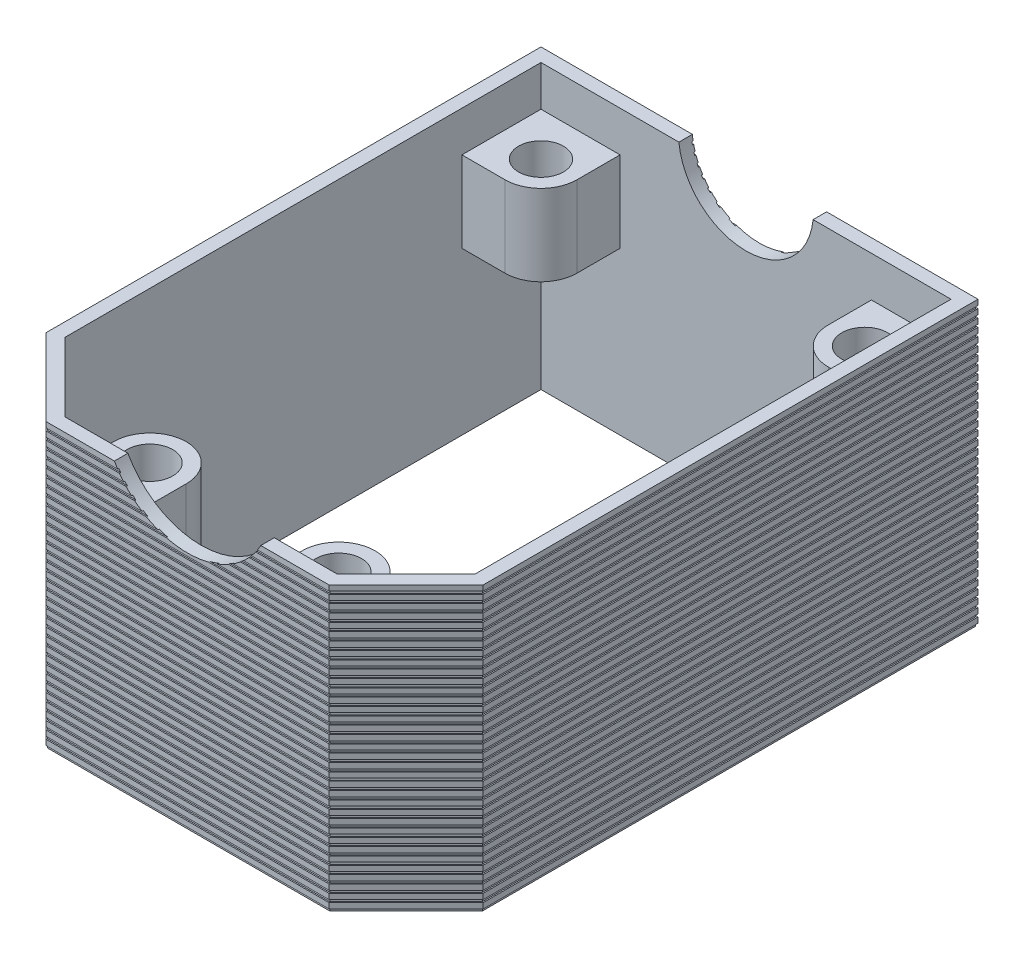
from build123d import *

# Parameters (mm, degrees)
BOSS_EXTRUDE1_DEPTH      = 9
BOSS_EXTRUDE1_DEPTH_BACK = 12
SKETCH4_R                = 1.7
SKETCH4_R_2              = 1.661505774
BOSS_EXTRUDE2_DEPTH      = 6
SKETCH6_R                = 6.2
CUT_EXTRUDE4_DEPTH       = 1
SKETCH5_R                = 5
CUT_EXTRUDE5_DEPTH       = 1
SKETCH7_W                = 32.4
SKETCH7_H                = 0.2
CUT_EXTRUDE6_DEPTH       = 0.09
SKETCH8_W                = 36.607056275
SKETCH8_H                = 0.2
CUT_EXTRUDE7_DEPTH       = 0.09
SKETCH9_W                = 8.065180362
SKETCH9_H                = 0.2
CUT_EXTRUDE8_DEPTH       = 0.09
SKETCH10_W               = 20.99411255
SKETCH10_H               = 0.2
CUT_EXTRUDE9_DEPTH       = 0.09
SKETCH11_W               = 8.065180362
SKETCH11_H               = 0.2
CUT_EXTRUDE10_DEPTH      = 0.09
SKETCH12_W               = 36.607056275
SKETCH12_H               = 0.2
CUT_EXTRUDE11_DEPTH      = 0.09


with BuildPart() as part:
    # Sketch2 → Boss-Extrude1 (new, two sides: drawn at the far end of the back side and taken through both)
    with BuildSketch(Plane(origin=(0, 0, 0), x_dir=(1, 0, 0), z_dir=(0, 1, 0)).offset(-BOSS_EXTRUDE1_DEPTH_BACK)):
        Polygon((-16.2, 21.2), (16.2, 21.2), (16.2, -15.497056275), (10.497056275, -21.2), (-10.497056275, -21.2), (-16.2, -15.497056275), align=None)
        Polygon((-15.2, 20.2), (15.2, 20.2), (15.2, -15.082842712), (10.082842712, -20.2), (-10.082842712, -20.2), (-15.2, -15.082842712), align=None, mode=Mode.SUBTRACT)
    extrude(amount=BOSS_EXTRUDE1_DEPTH + BOSS_EXTRUDE1_DEPTH_BACK)

    # Sketch4 → Boss-Extrude2 (add)
    # profile 1 of 4: a face of its own
    with BuildSketch(Plane(origin=(0, 0, 0), x_dir=(1, 0, 0), z_dir=(0, 1, 0))):
        with BuildLine():
            Line((9.3, 17), (9.3, 20.2))
            Line((9.3, 20.2), (15.2, 20.2))
            Line((15.2, 20.2), (15.2, 14.3))
            Line((15.2, 14.3), (12, 14.3))
            ThreePointArc((12, 14.3), (10.090811691, 15.090811691), (9.3, 17))
        make_face()
        with Locations(Location((12, 17, 0), (0, 0, 270))):
            Circle(SKETCH4_R, mode=Mode.SUBTRACT)
    # profile 2 of 4: a face of its own
    with BuildSketch(Plane(origin=(0, 0, 0), x_dir=(1, 0, 0), z_dir=(0, 1, 0))):
        with BuildLine():
            Line((-9.7, -17), (-9.7, -20.2))
            Line((-9.7, -20.2), (-4.3, -20.2))
            Line((-4.3, -20.2), (-4.3, -17))
            ThreePointArc((-4.3, -17), (-7, -14.3), (-9.7, -17))
        make_face()
        with Locations(Location((-7, -17, 0), (0, 0, 270))):
            Circle(SKETCH4_R, mode=Mode.SUBTRACT)
    # profile 3 of 4: a face of its own
    with BuildSketch(Plane(origin=(0, 0, 0), x_dir=(1, 0, 0), z_dir=(0, 1, 0))):
        with BuildLine():
            Line((4.3, -17), (4.3, -20.2))
            Line((4.3, -20.2), (9.7, -20.2))
            Line((9.7, -20.2), (9.7, -17))
            ThreePointArc((9.7, -17), (7, -14.3), (4.3, -17))
        make_face()
        with Locations(Location((7, -17, 0), (0, 0, 270))):
            Circle(SKETCH4_R, mode=Mode.SUBTRACT)
    # profile 4 of 4: a face of its own
    with BuildSketch(Plane(origin=(0, 0, 0), x_dir=(1, 0, 0), z_dir=(0, 1, 0))):
        with BuildLine():
            Line((-9.338494226, 17), (-9.338494226, 20.2))
            Line((-9.338494226, 20.2), (-15.2, 20.2))
            Line((-15.2, 20.2), (-15.2, 14.338494226))
            Line((-15.2, 14.338494226), (-12, 14.338494226))
            ThreePointArc((-12, 14.338494226), (-10.118031219, 15.118031219), (-9.338494226, 17))
        make_face()
        with Locations(Location((-12, 17, 0), (0, 0, 270))):
            Circle(SKETCH4_R_2, mode=Mode.SUBTRACT)
    extrude(amount=BOSS_EXTRUDE2_DEPTH)

    # Sketch6 → Cut-Extrude4 (cut)
    with BuildSketch(Plane.XY.offset(21.2)):
        with Locations((0, 12)):
            Circle(SKETCH6_R)
    extrude(amount=-CUT_EXTRUDE4_DEPTH, mode=Mode.SUBTRACT)

    # Sketch5 → Cut-Extrude5 (cut)
    with BuildSketch(Plane(origin=(0, 0, -21.2), x_dir=(-1, 0, 0), z_dir=(0, 0, -1))):
        with Locations((0, 9.5)):
            Circle(SKETCH5_R)
    extrude(amount=-CUT_EXTRUDE5_DEPTH, mode=Mode.SUBTRACT)

    # Sketch7 → Cut-Extrude6 (cut)
    with BuildSketch(Plane(origin=(0, 0, -21.2), x_dir=(-1, 0, 0), z_dir=(0, 0, -1))):
        with Locations((0, -11.9)):
            Rectangle(SKETCH7_W, SKETCH7_H)
        with Locations((0, -11.3)):
            Rectangle(SKETCH7_W, SKETCH7_H)
        with Locations((0, -10.7)):
            Rectangle(SKETCH7_W, SKETCH7_H)
        with Locations((0, -10.1)):
            Rectangle(SKETCH7_W, SKETCH7_H)
        with Locations((0, -9.5)):
            Rectangle(SKETCH7_W, SKETCH7_H)
        with Locations((0, -8.9)):
            Rectangle(SKETCH7_W, SKETCH7_H)
        with Locations((0, -8.3)):
            Rectangle(SKETCH7_W, SKETCH7_H)
        with Locations((0, -7.7)):
            Rectangle(SKETCH7_W, SKETCH7_H)
        with Locations((0, -7.1)):
            Rectangle(SKETCH7_W, SKETCH7_H)
        with Locations((0, -6.5)):
            Rectangle(SKETCH7_W, SKETCH7_H)
        with Locations((0, -5.9)):
            Rectangle(SKETCH7_W, SKETCH7_H)
        with Locations((0, -5.3)):
            Rectangle(SKETCH7_W, SKETCH7_H)
        with Locations((0, -4.7)):
            Rectangle(SKETCH7_W, SKETCH7_H)
        with Locations((0, -4.1)):
            Rectangle(SKETCH7_W, SKETCH7_H)
        with Locations((0, -3.5)):
            Rectangle(SKETCH7_W, SKETCH7_H)
        with Locations((0, -2.9)):
            Rectangle(SKETCH7_W, SKETCH7_H)
        with Locations((0, -2.3)):
            Rectangle(SKETCH7_W, SKETCH7_H)
        with Locations((0, -1.7)):
            Rectangle(SKETCH7_W, SKETCH7_H)
        with Locations((0, -1.1)):
            Rectangle(SKETCH7_W, SKETCH7_H)
        with Locations((0, -0.5)):
            Rectangle(SKETCH7_W, SKETCH7_H)
        with Locations((0, 0.1)):
            Rectangle(SKETCH7_W, SKETCH7_H)
        with Locations((0, 0.7)):
            Rectangle(SKETCH7_W, SKETCH7_H)
        with Locations((0, 1.3)):
            Rectangle(SKETCH7_W, SKETCH7_H)
        with Locations((0, 1.9)):
            Rectangle(SKETCH7_W, SKETCH7_H)
        with Locations((0, 2.5)):
            Rectangle(SKETCH7_W, SKETCH7_H)
        with Locations((0, 3.1)):
            Rectangle(SKETCH7_W, SKETCH7_H)
        with Locations((0, 3.7)):
            Rectangle(SKETCH7_W, SKETCH7_H)
        with Locations((0, 4.3)):
            Rectangle(SKETCH7_W, SKETCH7_H)
        with Locations((0, 4.9)):
            Rectangle(SKETCH7_W, SKETCH7_H)
        with Locations((0, 5.5)):
            Rectangle(SKETCH7_W, SKETCH7_H)
        with Locations((0, 6.1)):
            Rectangle(SKETCH7_W, SKETCH7_H)
        with Locations((0, 6.7)):
            Rectangle(SKETCH7_W, SKETCH7_H)
        with Locations((0, 7.3)):
            Rectangle(SKETCH7_W, SKETCH7_H)
        with Locations((0, 7.9)):
            Rectangle(SKETCH7_W, SKETCH7_H)
        with Locations((0, 8.5)):
            Rectangle(SKETCH7_W, SKETCH7_H)
        with Locations((0, 9.1)):
            Rectangle(SKETCH7_W, SKETCH7_H)
        with Locations((0, 9.7)):
            Rectangle(SKETCH7_W, SKETCH7_H)
        with Locations((0, 10.3)):
            Rectangle(SKETCH7_W, SKETCH7_H)
        with Locations((0, 10.9)):
            Rectangle(SKETCH7_W, SKETCH7_H)
        with Locations((0, 11.5)):
            Rectangle(SKETCH7_W, SKETCH7_H)
    extrude(amount=-CUT_EXTRUDE6_DEPTH, mode=Mode.SUBTRACT)

    # Sketch8 → Cut-Extrude7 (cut)
    with BuildSketch(Plane(origin=(16.2, 0, 0), x_dir=(0, 0, -1), z_dir=(1, 0, 0))):
        with Locations((2.806471863, -11.3)):
            Rectangle(SKETCH8_W, SKETCH8_H)
        with Locations((2.806471863, -11.9)):
            Rectangle(SKETCH8_W, SKETCH8_H)
        with Locations((2.806471863, -10.7)):
            Rectangle(SKETCH8_W, SKETCH8_H)
        with Locations((2.806471863, -10.1)):
            Rectangle(SKETCH8_W, SKETCH8_H)
        with Locations((2.806471863, -9.5)):
            Rectangle(SKETCH8_W, SKETCH8_H)
        with Locations((2.806471863, -8.9)):
            Rectangle(SKETCH8_W, SKETCH8_H)
        with Locations((2.806471863, -8.3)):
            Rectangle(SKETCH8_W, SKETCH8_H)
        with Locations((2.806471863, -7.7)):
            Rectangle(SKETCH8_W, SKETCH8_H)
        with Locations((2.806471863, -7.1)):
            Rectangle(SKETCH8_W, SKETCH8_H)
        with Locations((2.806471863, -6.5)):
            Rectangle(SKETCH8_W, SKETCH8_H)
        with Locations((2.806471863, -5.9)):
            Rectangle(SKETCH8_W, SKETCH8_H)
        with Locations((2.806471863, -5.3)):
            Rectangle(SKETCH8_W, SKETCH8_H)
        with Locations((2.806471863, -4.7)):
            Rectangle(SKETCH8_W, SKETCH8_H)
        with Locations((2.806471863, -4.1)):
            Rectangle(SKETCH8_W, SKETCH8_H)
        with Locations((2.806471863, -3.5)):
            Rectangle(SKETCH8_W, SKETCH8_H)
        with Locations((2.806471863, -2.9)):
            Rectangle(SKETCH8_W, SKETCH8_H)
        with Locations((2.806471863, -2.3)):
            Rectangle(SKETCH8_W, SKETCH8_H)
        with Locations((2.806471863, -1.7)):
            Rectangle(SKETCH8_W, SKETCH8_H)
        with Locations((2.806471863, -1.1)):
            Rectangle(SKETCH8_W, SKETCH8_H)
        with Locations((2.806471863, -0.5)):
            Rectangle(SKETCH8_W, SKETCH8_H)
        with Locations((2.806471863, 0.1)):
            Rectangle(SKETCH8_W, SKETCH8_H)
        with Locations((2.806471863, 0.7)):
            Rectangle(SKETCH8_W, SKETCH8_H)
        with Locations((2.806471863, 1.3)):
            Rectangle(SKETCH8_W, SKETCH8_H)
        with Locations((2.806471863, 1.9)):
            Rectangle(SKETCH8_W, SKETCH8_H)
        with Locations((2.806471863, 2.5)):
            Rectangle(SKETCH8_W, SKETCH8_H)
        with Locations((2.806471863, 3.1)):
            Rectangle(SKETCH8_W, SKETCH8_H)
        with Locations((2.806471863, 3.7)):
            Rectangle(SKETCH8_W, SKETCH8_H)
        with Locations((2.806471863, 4.3)):
            Rectangle(SKETCH8_W, SKETCH8_H)
        with Locations((2.806471863, 4.9)):
            Rectangle(SKETCH8_W, SKETCH8_H)
        with Locations((2.806471863, 5.5)):
            Rectangle(SKETCH8_W, SKETCH8_H)
        with Locations((2.806471863, 6.1)):
            Rectangle(SKETCH8_W, SKETCH8_H)
        with Locations((2.806471863, 6.7)):
            Rectangle(SKETCH8_W, SKETCH8_H)
        with Locations((2.806471863, 7.3)):
            Rectangle(SKETCH8_W, SKETCH8_H)
        with Locations((2.806471863, 7.9)):
            Rectangle(SKETCH8_W, SKETCH8_H)
        with Locations((2.806471863, 8.5)):
            Rectangle(SKETCH8_W, SKETCH8_H)
        with Locations((2.806471863, 9.1)):
            Rectangle(SKETCH8_W, SKETCH8_H)
        with Locations((2.806471863, 9.7)):
            Rectangle(SKETCH8_W, SKETCH8_H)
    extrude(amount=-CUT_EXTRUDE7_DEPTH, mode=Mode.SUBTRACT)

    # Sketch9 → Cut-Extrude8 (cut)
    with BuildSketch(Plane(origin=(15.848528137, 0, 15.848528137), x_dir=(0.7071067811865476, 0, -0.7071067811865476), z_dir=(0.7071067811865476, 0, 0.7071067811865476))):
        with Locations((-3.535533906, -11.3)):
            Rectangle(SKETCH9_W, SKETCH9_H)
        with Locations((-3.535533906, -11.9)):
            Rectangle(SKETCH9_W, SKETCH9_H)
        with Locations((-3.535533906, -10.7)):
            Rectangle(SKETCH9_W, SKETCH9_H)
        with Locations((-3.535533906, -10.1)):
            Rectangle(SKETCH9_W, SKETCH9_H)
        with Locations((-3.535533906, -9.5)):
            Rectangle(SKETCH9_W, SKETCH9_H)
        with Locations((-3.535533906, -8.9)):
            Rectangle(SKETCH9_W, SKETCH9_H)
        with Locations((-3.535533906, -8.3)):
            Rectangle(SKETCH9_W, SKETCH9_H)
        with Locations((-3.535533906, -7.7)):
            Rectangle(SKETCH9_W, SKETCH9_H)
        with Locations((-3.535533906, -7.1)):
            Rectangle(SKETCH9_W, SKETCH9_H)
        with Locations((-3.535533906, -6.5)):
            Rectangle(SKETCH9_W, SKETCH9_H)
        with Locations((-3.535533906, -5.9)):
            Rectangle(SKETCH9_W, SKETCH9_H)
        with Locations((-3.535533906, -5.3)):
            Rectangle(SKETCH9_W, SKETCH9_H)
        with Locations((-3.535533906, -4.7)):
            Rectangle(SKETCH9_W, SKETCH9_H)
        with Locations((-3.535533906, -4.1)):
            Rectangle(SKETCH9_W, SKETCH9_H)
        with Locations((-3.535533906, -3.5)):
            Rectangle(SKETCH9_W, SKETCH9_H)
        with Locations((-3.535533906, -2.9)):
            Rectangle(SKETCH9_W, SKETCH9_H)
        with Locations((-3.535533906, -2.3)):
            Rectangle(SKETCH9_W, SKETCH9_H)
        with Locations((-3.535533906, -1.7)):
            Rectangle(SKETCH9_W, SKETCH9_H)
        with Locations((-3.535533906, -1.1)):
            Rectangle(SKETCH9_W, SKETCH9_H)
        with Locations((-3.535533906, -0.5)):
            Rectangle(SKETCH9_W, SKETCH9_H)
        with Locations((-3.535533906, 0.1)):
            Rectangle(SKETCH9_W, SKETCH9_H)
        with Locations((-3.535533906, 0.7)):
            Rectangle(SKETCH9_W, SKETCH9_H)
        with Locations((-3.535533906, 1.3)):
            Rectangle(SKETCH9_W, SKETCH9_H)
        with Locations((-3.535533906, 1.9)):
            Rectangle(SKETCH9_W, SKETCH9_H)
        with Locations((-3.535533906, 2.5)):
            Rectangle(SKETCH9_W, SKETCH9_H)
        with Locations((-3.535533906, 3.1)):
            Rectangle(SKETCH9_W, SKETCH9_H)
        with Locations((-3.535533906, 3.7)):
            Rectangle(SKETCH9_W, SKETCH9_H)
        with Locations((-3.535533906, 4.3)):
            Rectangle(SKETCH9_W, SKETCH9_H)
        with Locations((-3.535533906, 4.9)):
            Rectangle(SKETCH9_W, SKETCH9_H)
        with Locations((-3.535533906, 5.5)):
            Rectangle(SKETCH9_W, SKETCH9_H)
        with Locations((-3.535533906, 6.1)):
            Rectangle(SKETCH9_W, SKETCH9_H)
        with Locations((-3.535533906, 6.7)):
            Rectangle(SKETCH9_W, SKETCH9_H)
        with Locations((-3.535533906, 7.3)):
            Rectangle(SKETCH9_W, SKETCH9_H)
        with Locations((-3.535533906, 7.9)):
            Rectangle(SKETCH9_W, SKETCH9_H)
        with Locations((-3.535533906, 8.5)):
            Rectangle(SKETCH9_W, SKETCH9_H)
        with Locations((-3.535533906, 9.1)):
            Rectangle(SKETCH9_W, SKETCH9_H)
        with Locations((-3.535533906, 9.7)):
            Rectangle(SKETCH9_W, SKETCH9_H)
    extrude(amount=-CUT_EXTRUDE8_DEPTH, mode=Mode.SUBTRACT)

    # Sketch10 → Cut-Extrude9 (cut)
    with BuildSketch(Plane.XY.offset(21.2)):
        with Locations((0, -11.3)):
            Rectangle(SKETCH10_W, SKETCH10_H)
        with Locations((0, -11.9)):
            Rectangle(SKETCH10_W, SKETCH10_H)
        with Locations((0, -10.7)):
            Rectangle(SKETCH10_W, SKETCH10_H)
        with Locations((0, -10.1)):
            Rectangle(SKETCH10_W, SKETCH10_H)
        with Locations((0, -9.5)):
            Rectangle(SKETCH10_W, SKETCH10_H)
        with Locations((0, -8.9)):
            Rectangle(SKETCH10_W, SKETCH10_H)
        with Locations((0, -8.3)):
            Rectangle(SKETCH10_W, SKETCH10_H)
        with Locations((0, -7.7)):
            Rectangle(SKETCH10_W, SKETCH10_H)
        with Locations((0, -7.1)):
            Rectangle(SKETCH10_W, SKETCH10_H)
        with Locations((0, -6.5)):
            Rectangle(SKETCH10_W, SKETCH10_H)
        with Locations((0, -5.9)):
            Rectangle(SKETCH10_W, SKETCH10_H)
        with Locations((0, -5.3)):
            Rectangle(SKETCH10_W, SKETCH10_H)
        with Locations((0, -4.7)):
            Rectangle(SKETCH10_W, SKETCH10_H)
        with Locations((0, -4.1)):
            Rectangle(SKETCH10_W, SKETCH10_H)
        with Locations((0, -3.5)):
            Rectangle(SKETCH10_W, SKETCH10_H)
        with Locations((0, -2.9)):
            Rectangle(SKETCH10_W, SKETCH10_H)
        with Locations((0, -2.3)):
            Rectangle(SKETCH10_W, SKETCH10_H)
        with Locations((0, -1.7)):
            Rectangle(SKETCH10_W, SKETCH10_H)
        with Locations((0, -1.1)):
            Rectangle(SKETCH10_W, SKETCH10_H)
        with Locations((0, -0.5)):
            Rectangle(SKETCH10_W, SKETCH10_H)
        with Locations((0, 0.1)):
            Rectangle(SKETCH10_W, SKETCH10_H)
        with Locations((0, 0.7)):
            Rectangle(SKETCH10_W, SKETCH10_H)
        with Locations((0, 1.3)):
            Rectangle(SKETCH10_W, SKETCH10_H)
        with Locations((0, 1.9)):
            Rectangle(SKETCH10_W, SKETCH10_H)
        with Locations((0, 2.5)):
            Rectangle(SKETCH10_W, SKETCH10_H)
        with Locations((0, 3.1)):
            Rectangle(SKETCH10_W, SKETCH10_H)
        with Locations((0, 3.7)):
            Rectangle(SKETCH10_W, SKETCH10_H)
        with Locations((0, 4.3)):
            Rectangle(SKETCH10_W, SKETCH10_H)
        with Locations((0, 4.9)):
            Rectangle(SKETCH10_W, SKETCH10_H)
        with Locations((0, 5.5)):
            Rectangle(SKETCH10_W, SKETCH10_H)
        with Locations((0, 6.1)):
            Rectangle(SKETCH10_W, SKETCH10_H)
        with Locations((0, 6.7)):
            Rectangle(SKETCH10_W, SKETCH10_H)
        with Locations((0, 7.3)):
            Rectangle(SKETCH10_W, SKETCH10_H)
        with Locations((0, 7.9)):
            Rectangle(SKETCH10_W, SKETCH10_H)
        with Locations((0, 8.5)):
            Rectangle(SKETCH10_W, SKETCH10_H)
        with Locations((0, 9.1)):
            Rectangle(SKETCH10_W, SKETCH10_H)
        with Locations((0, 9.7)):
            Rectangle(SKETCH10_W, SKETCH10_H)
    extrude(amount=-CUT_EXTRUDE9_DEPTH, mode=Mode.SUBTRACT)

    # Sketch11 → Cut-Extrude10 (cut)
    with BuildSketch(Plane(origin=(-15.848528137, 0, 15.848528137), x_dir=(0.7071067811865476, 0, 0.7071067811865476), z_dir=(-0.7071067811865476, 0, 0.7071067811865476))):
        with Locations((3.535533906, -11.3)):
            Rectangle(SKETCH11_W, SKETCH11_H)
        with Locations((3.535533906, -11.9)):
            Rectangle(SKETCH11_W, SKETCH11_H)
        with Locations((3.535533906, -10.7)):
            Rectangle(SKETCH11_W, SKETCH11_H)
        with Locations((3.535533906, -10.1)):
            Rectangle(SKETCH11_W, SKETCH11_H)
        with Locations((3.535533906, -9.5)):
            Rectangle(SKETCH11_W, SKETCH11_H)
        with Locations((3.535533906, -8.9)):
            Rectangle(SKETCH11_W, SKETCH11_H)
        with Locations((3.535533906, -8.3)):
            Rectangle(SKETCH11_W, SKETCH11_H)
        with Locations((3.535533906, -7.7)):
            Rectangle(SKETCH11_W, SKETCH11_H)
        with Locations((3.535533906, -7.1)):
            Rectangle(SKETCH11_W, SKETCH11_H)
        with Locations((3.535533906, -6.5)):
            Rectangle(SKETCH11_W, SKETCH11_H)
        with Locations((3.535533906, -5.9)):
            Rectangle(SKETCH11_W, SKETCH11_H)
        with Locations((3.535533906, -5.3)):
            Rectangle(SKETCH11_W, SKETCH11_H)
        with Locations((3.535533906, -4.7)):
            Rectangle(SKETCH11_W, SKETCH11_H)
        with Locations((3.535533906, -4.1)):
            Rectangle(SKETCH11_W, SKETCH11_H)
        with Locations((3.535533906, -3.5)):
            Rectangle(SKETCH11_W, SKETCH11_H)
        with Locations((3.535533906, -2.9)):
            Rectangle(SKETCH11_W, SKETCH11_H)
        with Locations((3.535533906, -2.3)):
            Rectangle(SKETCH11_W, SKETCH11_H)
        with Locations((3.535533906, -1.7)):
            Rectangle(SKETCH11_W, SKETCH11_H)
        with Locations((3.535533906, -1.1)):
            Rectangle(SKETCH11_W, SKETCH11_H)
        with Locations((3.535533906, -0.5)):
            Rectangle(SKETCH11_W, SKETCH11_H)
        with Locations((3.535533906, 0.1)):
            Rectangle(SKETCH11_W, SKETCH11_H)
        with Locations((3.535533906, 0.7)):
            Rectangle(SKETCH11_W, SKETCH11_H)
        with Locations((3.535533906, 1.3)):
            Rectangle(SKETCH11_W, SKETCH11_H)
        with Locations((3.535533906, 1.9)):
            Rectangle(SKETCH11_W, SKETCH11_H)
        with Locations((3.535533906, 2.5)):
            Rectangle(SKETCH11_W, SKETCH11_H)
        with Locations((3.535533906, 3.1)):
            Rectangle(SKETCH11_W, SKETCH11_H)
        with Locations((3.535533906, 3.7)):
            Rectangle(SKETCH11_W, SKETCH11_H)
        with Locations((3.535533906, 4.3)):
            Rectangle(SKETCH11_W, SKETCH11_H)
        with Locations((3.535533906, 4.9)):
            Rectangle(SKETCH11_W, SKETCH11_H)
        with Locations((3.535533906, 5.5)):
            Rectangle(SKETCH11_W, SKETCH11_H)
        with Locations((3.535533906, 6.1)):
            Rectangle(SKETCH11_W, SKETCH11_H)
        with Locations((3.535533906, 6.7)):
            Rectangle(SKETCH11_W, SKETCH11_H)
        with Locations((3.535533906, 7.3)):
            Rectangle(SKETCH11_W, SKETCH11_H)
        with Locations((3.535533906, 7.9)):
            Rectangle(SKETCH11_W, SKETCH11_H)
        with Locations((3.535533906, 8.5)):
            Rectangle(SKETCH11_W, SKETCH11_H)
        with Locations((3.535533906, 9.1)):
            Rectangle(SKETCH11_W, SKETCH11_H)
        with Locations((3.535533906, 9.7)):
            Rectangle(SKETCH11_W, SKETCH11_H)
    extrude(amount=-CUT_EXTRUDE10_DEPTH, mode=Mode.SUBTRACT)

    # Sketch12 → Cut-Extrude11 (cut)
    with BuildSketch(Plane.ZY.offset(16.2)):
        with Locations((-2.806471863, -11.3)):
            Rectangle(SKETCH12_W, SKETCH12_H)
        with Locations((-2.806471863, -11.9)):
            Rectangle(SKETCH12_W, SKETCH12_H)
        with Locations((-2.806471863, -10.7)):
            Rectangle(SKETCH12_W, SKETCH12_H)
        with Locations((-2.806471863, -10.1)):
            Rectangle(SKETCH12_W, SKETCH12_H)
        with Locations((-2.806471863, -9.5)):
            Rectangle(SKETCH12_W, SKETCH12_H)
        with Locations((-2.806471863, -8.9)):
            Rectangle(SKETCH12_W, SKETCH12_H)
        with Locations((-2.806471863, -8.3)):
            Rectangle(SKETCH12_W, SKETCH12_H)
        with Locations((-2.806471863, -7.7)):
            Rectangle(SKETCH12_W, SKETCH12_H)
        with Locations((-2.806471863, -7.1)):
            Rectangle(SKETCH12_W, SKETCH12_H)
        with Locations((-2.806471863, -6.5)):
            Rectangle(SKETCH12_W, SKETCH12_H)
        with Locations((-2.806471863, -5.9)):
            Rectangle(SKETCH12_W, SKETCH12_H)
        with Locations((-2.806471863, -5.3)):
            Rectangle(SKETCH12_W, SKETCH12_H)
        with Locations((-2.806471863, -4.7)):
            Rectangle(SKETCH12_W, SKETCH12_H)
        with Locations((-2.806471863, -4.1)):
            Rectangle(SKETCH12_W, SKETCH12_H)
        with Locations((-2.806471863, -3.5)):
            Rectangle(SKETCH12_W, SKETCH12_H)
        with Locations((-2.806471863, -2.9)):
            Rectangle(SKETCH12_W, SKETCH12_H)
        with Locations((-2.806471863, -2.3)):
            Rectangle(SKETCH12_W, SKETCH12_H)
        with Locations((-2.806471863, -1.7)):
            Rectangle(SKETCH12_W, SKETCH12_H)
        with Locations((-2.806471863, -1.1)):
            Rectangle(SKETCH12_W, SKETCH12_H)
        with Locations((-2.806471863, -0.5)):
            Rectangle(SKETCH12_W, SKETCH12_H)
        with Locations((-2.806471863, 0.1)):
            Rectangle(SKETCH12_W, SKETCH12_H)
        with Locations((-2.806471863, 0.7)):
            Rectangle(SKETCH12_W, SKETCH12_H)
        with Locations((-2.806471863, 1.3)):
            Rectangle(SKETCH12_W, SKETCH12_H)
        with Locations((-2.806471863, 1.9)):
            Rectangle(SKETCH12_W, SKETCH12_H)
        with Locations((-2.806471863, 2.5)):
            Rectangle(SKETCH12_W, SKETCH12_H)
        with Locations((-2.806471863, 3.1)):
            Rectangle(SKETCH12_W, SKETCH12_H)
        with Locations((-2.806471863, 3.7)):
            Rectangle(SKETCH12_W, SKETCH12_H)
        with Locations((-2.806471863, 4.3)):
            Rectangle(SKETCH12_W, SKETCH12_H)
        with Locations((-2.806471863, 4.9)):
            Rectangle(SKETCH12_W, SKETCH12_H)
        with Locations((-2.806471863, 5.5)):
            Rectangle(SKETCH12_W, SKETCH12_H)
        with Locations((-2.806471863, 6.1)):
            Rectangle(SKETCH12_W, SKETCH12_H)
        with Locations((-2.806471863, 6.7)):
            Rectangle(SKETCH12_W, SKETCH12_H)
        with Locations((-2.806471863, 7.3)):
            Rectangle(SKETCH12_W, SKETCH12_H)
        with Locations((-2.806471863, 7.9)):
            Rectangle(SKETCH12_W, SKETCH12_H)
        with Locations((-2.806471863, 8.5)):
            Rectangle(SKETCH12_W, SKETCH12_H)
        with Locations((-2.806471863, 9.1)):
            Rectangle(SKETCH12_W, SKETCH12_H)
        with Locations((-2.806471863, 9.7)):
            Rectangle(SKETCH12_W, SKETCH12_H)
    extrude(amount=-CUT_EXTRUDE11_DEPTH, mode=Mode.SUBTRACT)


solid = part.part
